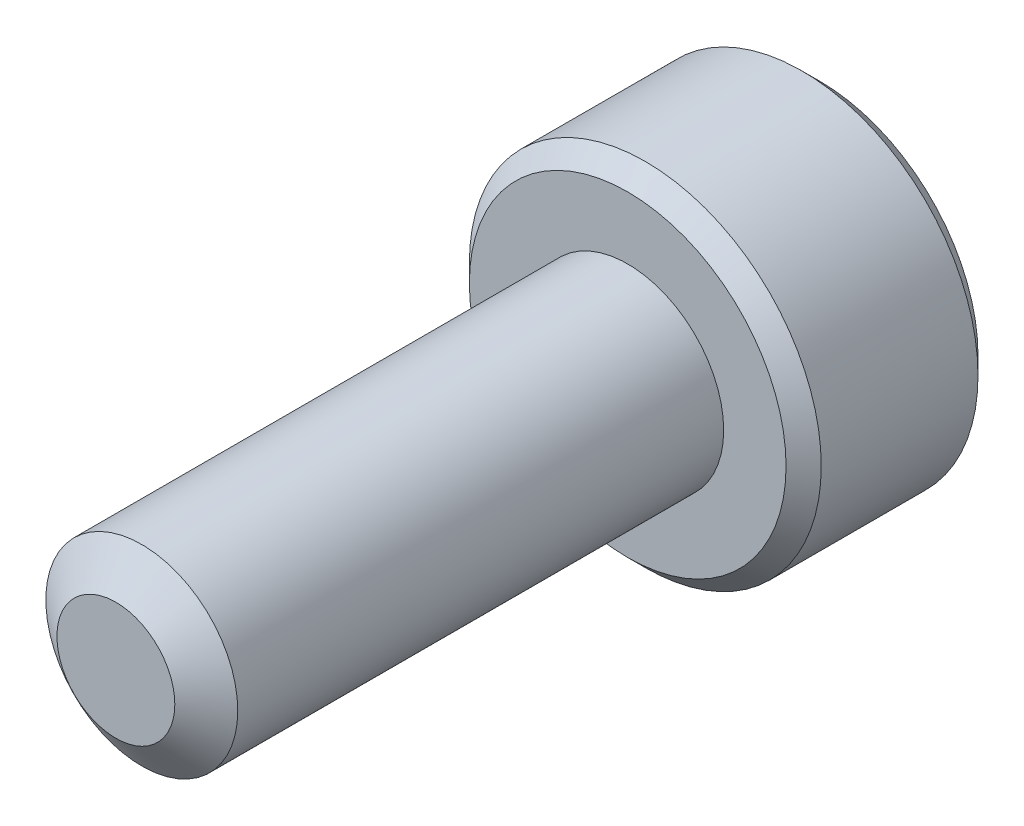
from build123d import *

# Parameters (mm, degrees)
SKETCH1_R          = 1.5
EXTRUDE1_DEPTH     = 8
SKETCH6_R          = 2.75
EXTRUDE2_DEPTH     = 3
CUT_EXTRUDE1_DEPTH = 1.875
CHAMFER1_SIZE      = 0.275


with BuildPart() as part:
    # Sketch1 → Extrude1 (new body)
    with BuildSketch(Plane.XY):
        Circle(SKETCH1_R)
    extrude(amount=-EXTRUDE1_DEPTH)

    # Sketch4 → Cut-Revolve1 (revolve, cut)
    with BuildSketch(Plane(origin=(0, 0, 0), x_dir=(0, 0, -1), z_dir=(1, 0, 0))):
        Polygon((0.405251783, 1.5), (0, 0.921240474), (0, 1.5), align=None)
    revolve(axis=Axis((0, 0, 0), (0, 0, -1)), mode=Mode.SUBTRACT)

    # Sketch6 → Extrude2 (add)
    with BuildSketch(Plane(origin=(0, 0, -8), x_dir=(-1, 0, 0), z_dir=(0, 0, -1))):
        Circle(SKETCH6_R)
    extrude(amount=EXTRUDE2_DEPTH)

    # Sketch7 → Cut-Extrude1 (cut)
    with BuildSketch(Plane(origin=(0, 0, -11), x_dir=(-1, 0, 0), z_dir=(0, 0, -1))):
        Polygon((0, 1.443375673), (-1.25, 0.721687836), (-1.25, -0.721687836), (0, -1.443375673), (1.25, -0.721687836), (1.25, 0.721687836), align=None)
    extrude(amount=-CUT_EXTRUDE1_DEPTH, mode=Mode.SUBTRACT)

    # Cut-Extrude2 cone 1 section (through the dimple's axis) → Cut-Extrude2 (revolve, cut)
    with BuildSketch(Plane(origin=(0, 0, -11), x_dir=(0, 1, 0), z_dir=(1, 0, 0))):
        Polygon((0, 0), (1.443375673, 0), (0, 1.443375673), align=None)
    revolve(axis=Axis((0, 0, -11), (0, 0, 1)), mode=Mode.SUBTRACT)

    # Chamfer1
    chamfer1_edges = [part.edges().sort_by_distance(p)[0] for p in [
        (2.75, 0, -11),
        (2.75, 0, -8),
    ]]
    chamfer(chamfer1_edges, length=CHAMFER1_SIZE)


solid = part.part
